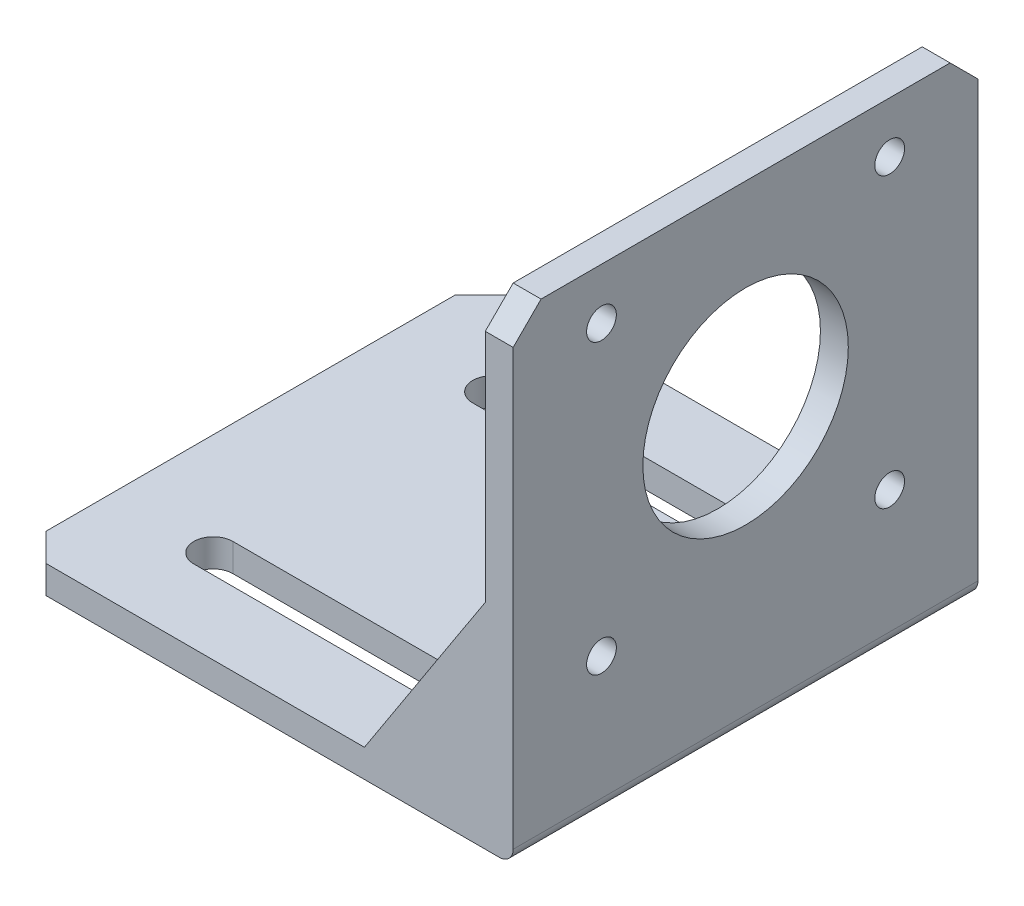
from build123d import *

# Parameters (mm, degrees)
EXTRUDE_1_DEPTH             = 50
HOLE_WIZARD_1_D             = 22.1
HOLE_WIZARD_1_DEPTH         = 100
HOLE_WIZARD_2_D             = 3.2
HOLE_WIZARD_2_DEPTH         = 100
HOLE_START                  = -3
HOLE_WIZARD_4_2_4_2_1_DEPTH = 3
RIB_1_REACH                 = 89.542
SKETCH_13_WALL_W            = 200.93798631
SKETCH_13_WALL_H            = 2.1
CHAMFER_1_SIZE              = 3
FILLET_1_R                  = 1.5
FILLET_2_R                  = 1.5


# Read off the part's stored shape, not the designer's step: Ø4.2 (4.2) 直径槽口1
with BuildPart() as part:
    # 草图1 → 凸台-拉伸1 (new body)
    with BuildSketch(Plane.XY):
        Polygon((0, 0), (50.25, 0), (50.25, 48.25), (53.25, 48.25), (53.25, -3), (0, -3), align=None)
    extrude(amount=EXTRUDE_1_DEPTH)

    # 孔1
    with Locations(Plane.ZY.offset(-50.25)):
        with Locations((25, 27.25)):
            Hole(HOLE_WIZARD_1_D / 2, depth=HOLE_WIZARD_1_DEPTH)

    # 孔2
    with Locations(Plane.ZY.offset(-50.25)):
        with Locations((9.5, 42.75), (40.5, 42.75), (40.5, 11.75), (9.5, 11.75)):
            Hole(HOLE_WIZARD_2_D / 2, depth=HOLE_WIZARD_2_DEPTH)

    # Ø4.2 (4.2) 直径槽口1 outline → Ø4.2 (4.2) 直径槽口1 (cut)
    with BuildSketch(Plane(origin=(0, 0, 0), x_dir=(1, 0, 0), z_dir=(0, 1, 0)).offset(HOLE_START)):
        with BuildLine():
            Line((11, -42.1), (41, -42.1))
            ThreePointArc((41, -42.1), (43.1, -40), (41, -37.9))
            Line((41, -37.9), (11, -37.9))
            ThreePointArc((11, -37.9), (8.9, -40), (11, -42.1))
        make_face()
        with BuildLine():
            Line((11, -12.1), (41, -12.1))
            ThreePointArc((41, -12.1), (43.1, -10), (41, -7.9))
            Line((41, -7.9), (11, -7.9))
            ThreePointArc((11, -7.9), (8.9, -10), (11, -12.1))
        make_face()
    extrude(amount=HOLE_WIZARD_4_2_4_2_1_DEPTH, mode=Mode.SUBTRACT)

    # 草图13 wall → 筋1 (add, up to next)
    with BuildSketch(Plane(origin=(43.75, 10, 50), x_dir=(-0.544988350595, -0.838443616301, 0), z_dir=(0.838443616301, -0.544988350595, 0)), mode=Mode.PRIVATE) as rib_1_sk1:
        with Locations((0, 1.05)):
            Rectangle(SKETCH_13_WALL_W, SKETCH_13_WALL_H)
    rib_1_tool1 = extrude(rib_1_sk1.sketch, amount=RIB_1_REACH, mode=Mode.PRIVATE) - part.part
    rib_1 = rib_1_tool1.solids().sort_by_distance((43.75, 10, 50))[0]
    add(rib_1)

    # 镜向1: 筋1 across plane
    add(rib_1.mirror(Plane.XY.offset(25)))

    # 倒角1
    chamfer_1_edges = [part.edges().sort_by_distance(p)[0] for p in [
        (51.75, 48.25, 50),
        (0, -1.5, 50),
        (51.75, 48.25, 0),
        (0, -1.5, 0),
    ]]
    chamfer(chamfer_1_edges, length=CHAMFER_1_SIZE)

    # 圆角1
    fillet_1_edges = [part.edges().sort_by_distance(p)[0] for p in [
        (53.25, -3, 25),
    ]]
    fillet(fillet_1_edges, radius=FILLET_1_R)

    # 圆角2
    fillet_2_edges = [part.edges().sort_by_distance(p)[0] for p in [
        (50.25, 0, 25),
    ]]
    fillet(fillet_2_edges, radius=FILLET_2_R)


solid = part.part
